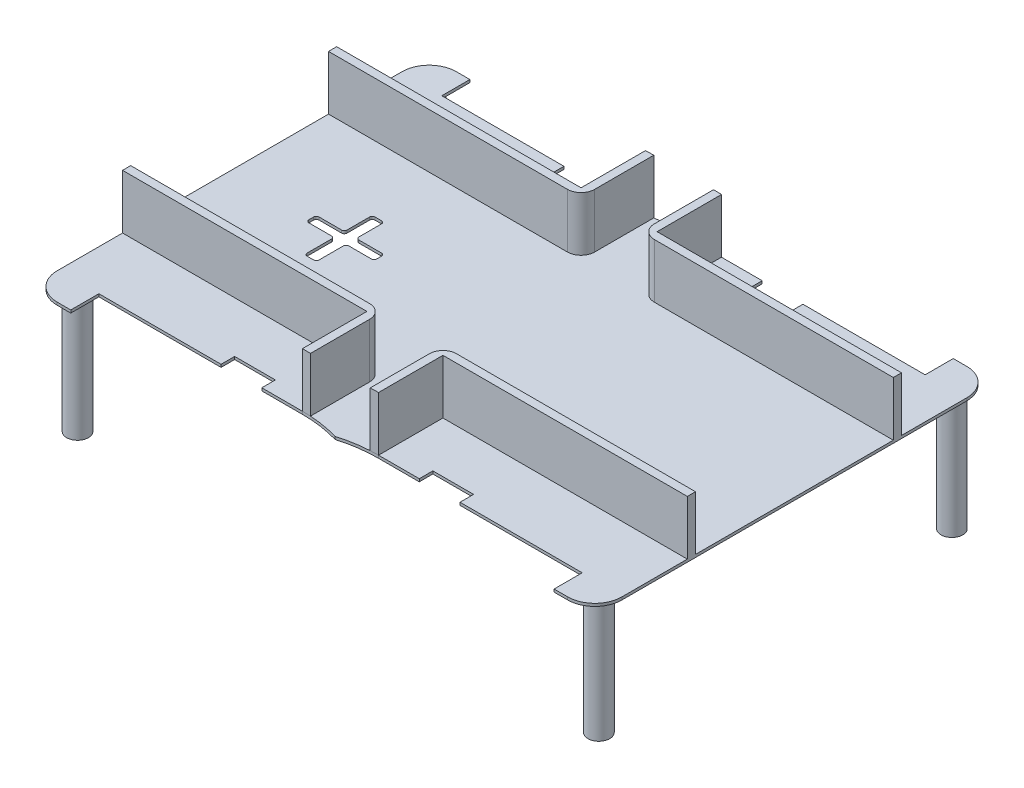
from build123d import *

# Parameters (mm, degrees)
SKETCH1_W            = 208
SKETCH1_H            = 147
BOSS_EXTRUDE1_DEPTH  = 1
CUT_EXTRUDE1_DEPTH   = 128.354819304
MIRROR2_COPY_1_DEPTH = 128.354819304
FILLET1_R            = 10
CUT_EXTRUDE2_DEPTH   = 128.354819304
BOSS_EXTRUDE2_DEPTH  = 20
FILLET2_R            = 5
FILLET2_OF_MIRROR3_R = 5
MIRROR4_START        = 1
MIRROR4_DEPTH        = 20
SKETCH7_R            = 4
BOSS_EXTRUDE3_DEPTH  = 45
SKETCH8_R            = 3
CUT_EXTRUDE4_DEPTH   = 30


# Read off the part's stored shape, not the designer's step: Mirror4
with BuildPart() as part:
    # Sketch1 → Boss-Extrude1 (new body)
    with BuildSketch(Plane(origin=(0, 0, 0), x_dir=(1, 0, 0), z_dir=(0, 1, 0))):
        Rectangle(SKETCH1_W, SKETCH1_H)
    extrude(amount=BOSS_EXTRUDE1_DEPTH)

    # Sketch3 → Cut-Extrude1 (cut, through all)
    with BuildSketch(Plane(origin=(0, 1, 0), x_dir=(1, 0, 0), z_dir=(0, 1, 0))):
        with BuildLine():
            Line((-89, 83.145473262), (-89, 63.145473262))
            Line((-89, 63.145473262), (-44, 63.145473262))
            Line((-44, 63.145473262), (-44, 58.145473262))
            Line((-44, 58.145473262), (-29, 58.145473262))
            Line((-29, 58.145473262), (-29, 63.145473262))
            Line((-29, 63.145473262), (-14, 63.145473262))
            ThreePointArc((-14, 63.145473262), (-6.928932188, 63.647998579), (0, 65.145473262))
            Line((0, 65.145473262), (0, 85.145473262))
            Line((0, 85.145473262), (-89, 85.145473262))
            Line((-89, 85.145473262), (-89, 83.145473262))
        make_face()
    cut_extrude1 = extrude(amount=-CUT_EXTRUDE1_DEPTH, mode=Mode.SUBTRACT)

    # Mirror1: Cut-Extrude1 across plane
    add(cut_extrude1.mirror(Plane.XY), mode=Mode.SUBTRACT)

    # Mirror2: Cut-Extrude1 across plane
    add(cut_extrude1.mirror(Plane(origin=(0, 0, 0), x_dir=(0, 0, 1), z_dir=(1, 0, 0))), mode=Mode.SUBTRACT)

    # Mirror2 copy 1 sketch → Mirror2 copy 1 (cut, through all)
    with BuildSketch(Plane(origin=(0, 1, 0), x_dir=(-1, 0, 0), z_dir=(0, 1, 0))):
        with BuildLine():
            Line((-89, 83.145473262), (-89, 63.145473262))
            Line((-89, 63.145473262), (-44, 63.145473262))
            Line((-44, 63.145473262), (-44, 58.145473262))
            Line((-44, 58.145473262), (-29, 58.145473262))
            Line((-29, 58.145473262), (-29, 63.145473262))
            Line((-29, 63.145473262), (-14, 63.145473262))
            ThreePointArc((-14, 63.145473262), (-6.928932188, 63.647998579), (0, 65.145473262))
            Line((0, 65.145473262), (0, 85.145473262))
            Line((0, 85.145473262), (-89, 85.145473262))
            Line((-89, 85.145473262), (-89, 83.145473262))
        make_face()
    extrude(amount=-MIRROR2_COPY_1_DEPTH, mode=Mode.SUBTRACT)

    # Fillet1
    fillet1_edges = [part.edges().sort_by_distance(p)[0] for p in [
        (104, 0.5, 73.5),
        (-104, 0.5, 73.5),
        (-104, 0.5, -73.5),
        (104, 0.5, -73.5),
    ]]
    fillet(fillet1_edges, radius=FILLET1_R)

    # Sketch4 → Cut-Extrude2 (cut, through all)
    with BuildSketch(Plane.XZ):
        with BuildLine():
            Line((-58.225796132, 1.876244538), (-49.924870206, 1.876244538))
            ThreePointArc((-49.924870206, 1.876244538), (-49.217763425, 1.583351319), (-48.924870206, 0.876244538))
            Line((-48.924870206, 0.876244538), (-48.924870206, -0.876244538))
            ThreePointArc((-48.924870206, -0.876244538), (-49.217763425, -1.583351319), (-49.924870206, -1.876244538))
            Line((-49.924870206, -1.876244538), (-58.225796132, -1.876244538))
            ThreePointArc((-58.225796132, -1.876244538), (-58.932902913, -2.169137757), (-59.225796132, -2.876244538))
            Line((-59.225796132, -2.876244538), (-59.225796132, -11.176244538))
            ThreePointArc((-59.225796132, -11.176244538), (-59.518689351, -11.883351319), (-60.225796132, -12.176244538))
            Line((-60.225796132, -12.176244538), (-62.62394428, -12.176244538))
            ThreePointArc((-62.62394428, -12.176244538), (-63.331051061, -11.883351319), (-63.62394428, -11.176244538))
            Line((-63.62394428, -11.176244538), (-63.62394428, -2.876244538))
            ThreePointArc((-63.62394428, -2.876244538), (-63.916837499, -2.169137757), (-64.62394428, -1.876244538))
            Line((-64.62394428, -1.876244538), (-72.924870206, -1.876244538))
            ThreePointArc((-72.924870206, -1.876244538), (-73.631976987, -1.583351319), (-73.924870206, -0.876244538))
            Line((-73.924870206, -0.876244538), (-73.924870206, 0.876244538))
            ThreePointArc((-73.924870206, 0.876244538), (-73.631976987, 1.583351319), (-72.924870206, 1.876244538))
            Line((-72.924870206, 1.876244538), (-64.62394428, 1.876244538))
            ThreePointArc((-64.62394428, 1.876244538), (-63.916837499, 2.169137757), (-63.62394428, 2.876244538))
            Line((-63.62394428, 2.876244538), (-63.62394428, 11.823755462))
            ThreePointArc((-63.62394428, 11.823755462), (-63.331051061, 12.530862243), (-62.62394428, 12.823755462))
            Line((-62.62394428, 12.823755462), (-60.225796132, 12.823755462))
            ThreePointArc((-60.225796132, 12.823755462), (-59.518689351, 12.530862243), (-59.225796132, 11.823755462))
            Line((-59.225796132, 11.823755462), (-59.225796132, 2.876244538))
            ThreePointArc((-59.225796132, 2.876244538), (-58.932902913, 2.169137757), (-58.225796132, 1.876244538))
        make_face()
    extrude(amount=-CUT_EXTRUDE2_DEPTH, mode=Mode.SUBTRACT)

    # Sketch5 → Boss-Extrude2 (add)
    with BuildSketch(Plane(origin=(0, 1, 0), x_dir=(1, 0, 0), z_dir=(0, 1, 0))):
        Polygon((-104, 36.429300806), (-11, 36.429300806), (-11, 63.235554408), (-14, 63.145473262), (-14, 39.429300806), (-104, 39.429300806), align=None)
    boss_extrude2 = extrude(amount=BOSS_EXTRUDE2_DEPTH)

    # Fillet2
    fillet2_edges = [part.edges().sort_by_distance(p)[0] for p in [
        (-11, 11, -36.429300806),
    ]]
    fillet(fillet2_edges, radius=FILLET2_R)

    # Mirror3: Boss-Extrude2 across plane
    add(boss_extrude2.mirror(Plane.XY))

    # Fillet2 of Mirror3
    fillet2_of_mirror3_edges = [part.edges().sort_by_distance(p)[0] for p in [
        (-11, 11, 36.429300806),
    ]]
    fillet(fillet2_of_mirror3_edges, radius=FILLET2_OF_MIRROR3_R)

    # Mirror4 outline → Mirror4 (add)
    with BuildSketch(Plane(origin=(0, 0, 0), x_dir=(1, 0, 0), z_dir=(0, 1, 0)).offset(MIRROR4_START)):
        with BuildLine():
            Line((104, -39.429300806), (104, -36.429300806))
            Line((104, -36.429300806), (16, -36.429300806))
            ThreePointArc((16, -36.429300806), (12.464466094, -37.8937669), (11, -41.429300806))
            Line((11, -41.429300806), (11, -63.235554408))
            Line((11, -63.235554408), (14, -63.145473262))
            Line((14, -63.145473262), (14, -39.429300806))
            Line((14, -39.429300806), (104, -39.429300806))
        make_face()
        with BuildLine():
            Line((104, 36.429300806), (104, 39.429300806))
            Line((104, 39.429300806), (14, 39.429300806))
            Line((14, 39.429300806), (14, 63.145473262))
            Line((14, 63.145473262), (11, 63.235554408))
            Line((11, 63.235554408), (11, 41.429300806))
            ThreePointArc((11, 41.429300806), (12.464466094, 37.8937669), (16, 36.429300806))
            Line((16, 36.429300806), (104, 36.429300806))
        make_face()
    extrude(amount=MIRROR4_DEPTH)

    # Sketch7 → Boss-Extrude3 (add)
    with BuildSketch(Plane.XZ):
        with Locations(Location((97, 65, 0), (0, 0, 90))):
            Circle(SKETCH7_R)
        with Locations(Location((-95, 65, 0), (0, 0, 90))):
            Circle(SKETCH7_R)
        with Locations(Location((-95, -65, 0), (0, 0, 90))):
            Circle(SKETCH7_R)
        with Locations(Location((97, -65, 0), (0, 0, 90))):
            Circle(SKETCH7_R)
    extrude(amount=BOSS_EXTRUDE3_DEPTH)

    # Sketch8 → Cut-Extrude4 (cut)
    with BuildSketch(Plane(origin=(0, -45, 0), x_dir=(-1, 0, 0), z_dir=(0, -1, 0))):
        with Locations(Location((95, 65, 0), (0, 0, 90))):
            Circle(SKETCH8_R)
        with Locations(Location((95, -65, 0), (0, 0, 90))):
            Circle(SKETCH8_R)
        with Locations(Location((-97, -65, 0), (0, 0, 90))):
            Circle(SKETCH8_R)
        with Locations(Location((-97, 65, 0), (0, 0, 90))):
            Circle(SKETCH8_R)
    extrude(amount=-CUT_EXTRUDE4_DEPTH, mode=Mode.SUBTRACT)


solid = part.part
